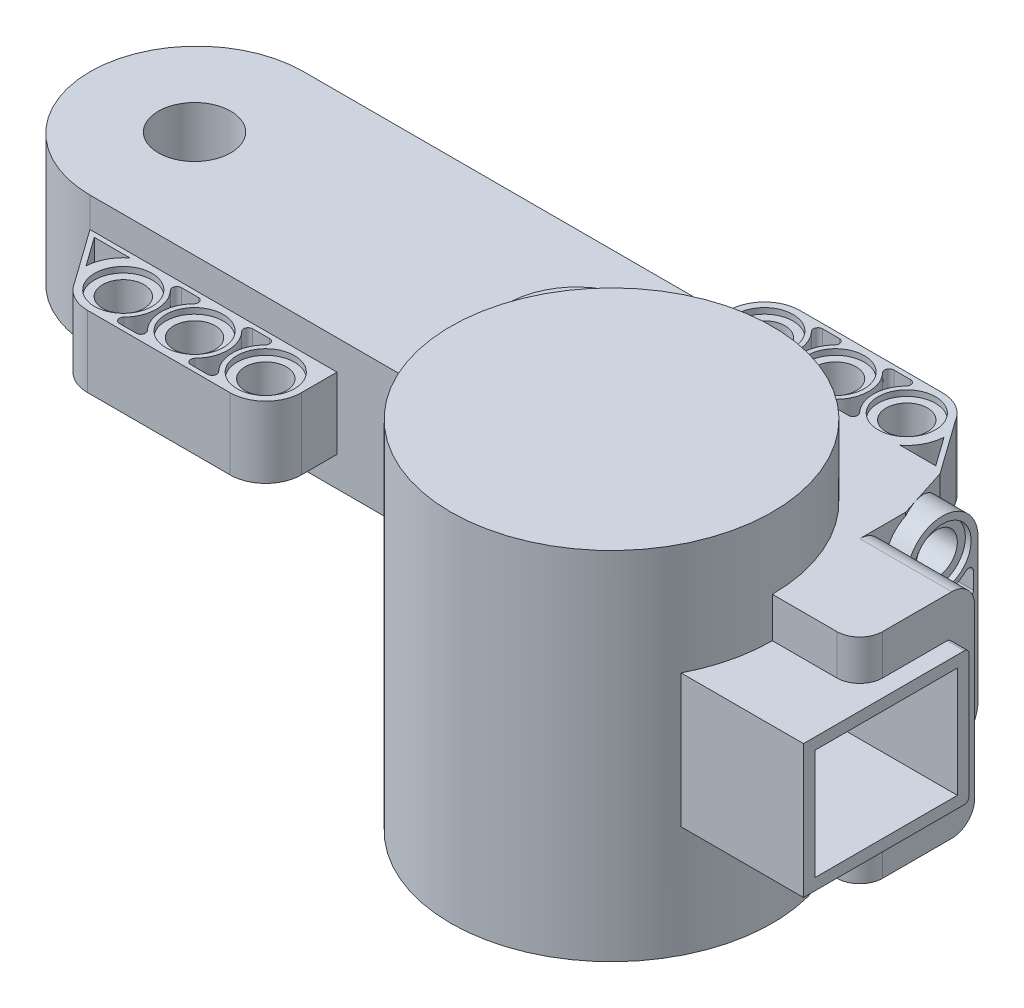
from build123d import *
from OCP.BRepAlgoAPI import BRepAlgoAPI_Cut
from OCP.TopTools import TopTools_ListOfShape

# Parameters (mm, degrees)
EXTRUDE1_DEPTH          = 3.937
SKETCH2_R               = 3.175
CUT_EXTRUDE1_DEPTH      = 0.635
SKETCH3_R               = 2.286
CUT_EXTRUDE2_DEPTH      = 21.34459137
LPATTERN12_COUNT        = 3
LPATTERN12_PITCH        = 7.874
CUT_EXTRUDE4_DEPTH      = 3.175
LPATTERN13_COUNT        = 2
LPATTERN13_PITCH        = 7.874
EXTRUDE2_START          = -7.874
EXTRUDE2_DEPTH          = 7.874
EXTRUDE3_DEPTH          = 7.874
EXTRUDE4_DEPTH          = 7.874
SKETCH9_R               = 17.78
EXTRUDE5_DEPTH          = 9.525
FILLET1_R               = 2.54
SKETCH10_W              = 18.288
SKETCH10_H              = 3.429
CUT_EXTRUDE5_DEPTH      = 12.065
FILLET2_R               = 0.508
CUT_EXTRUDE6_DEPTH      = 31.75
BODY_MOVE_COPY8_ANGLE   = 90
EXTRUDE6_DEPTH          = 3.937
EXTRUDE6_DEPTH_BACK     = 3.81
SKETCH13_R              = 4.0005
CUT_EXTRUDE7_DEPTH      = 95.795270547
EXTRUDE7_DEPTH          = 3.937
EXTRUDE12_DEPTH         = 0.508
BODY_MOVE_COPY2_ANGLE   = 180
SKETCH16_W              = 15.748
SKETCH16_H              = 12.192
EXTRUDE8_DEPTH          = 13.97
EXTRUDE13_START         = -1.651
EXTRUDE13_OUTLINE_R     = 17.78
EXTRUDE13_DEPTH         = 1.651
SKETCH24_R              = 17.78
EXTRUDE14_DEPTH         = 1.651
BOSS_EXTRUDE1_DEPTH     = 26.27892146
SKETCH31_W              = 1.651
SKETCH31_H              = 7.874
BOSS_EXTRUDE2_DEPTH     = 23.622
CUT_EXTRUDE8_DEPTH      = 0.762
CUT_EXTRUDE8_DEPTH_BACK = 0.254


with BuildPart() as part:
    # Sketch1 → Extrude1 (new body)
    with BuildSketch(Plane(origin=(0, 0, 0), x_dir=(1, 0, 0), z_dir=(0, 1, 0))):
        with BuildLine():
            Line((-15.748, -3.937), (0, -3.937))
            ThreePointArc((0, -3.937), (3.937, 0), (0, 3.937))
            Line((0, 3.937), (-15.748, 3.937))
            ThreePointArc((-15.748, 3.937), (-19.685, 0), (-15.748, -3.937))
        make_face()
    extrude(amount=EXTRUDE1_DEPTH)

    # Sketch2 → Cut-Extrude1 (cut)
    with BuildSketch(Plane.XZ):
        with Locations(Location((0, 0, 0), (0, 0, 270))):
            Circle(SKETCH2_R)
    cut_extrude1 = extrude(amount=-CUT_EXTRUDE1_DEPTH, mode=Mode.SUBTRACT)

    # Sketch3 → Cut-Extrude2 (cut, through all)
    with BuildSketch(Plane.XZ.offset(-0.635)):
        with Locations(Location((0, 0, 0), (0, 0, 270))):
            Circle(SKETCH3_R)
    cut_extrude2 = extrude(amount=-CUT_EXTRUDE2_DEPTH, mode=Mode.SUBTRACT)

    # LPattern12: Cut-Extrude1, Cut-Extrude2 ×3
    with Locations(*[(-i * LPATTERN12_PITCH, 0, 0) for i in range(1, LPATTERN12_COUNT)]):
        add(cut_extrude1, mode=Mode.SUBTRACT)
        add(cut_extrude2, mode=Mode.SUBTRACT)

    # Sketch5 → Cut-Extrude4 (cut)
    with BuildSketch(Plane.XZ):
        with BuildLine():
            Line((-4.86863147, 3.429), (-3.00536853, 3.429))
            ThreePointArc((-3.00536853, 3.429), (-2.537433284, 3.118738732), (-2.641081435, 2.566939394))
            ThreePointArc((-2.641081435, 2.566939394), (-3.683, 0), (-2.641081435, -2.566939394))
            ThreePointArc((-2.641081435, -2.566939394), (-2.537433284, -3.118738732), (-3.00536853, -3.429))
            Line((-3.00536853, -3.429), (-4.86863147, -3.429))
            ThreePointArc((-4.86863147, -3.429), (-5.336566716, -3.118738732), (-5.232918565, -2.566939394))
            ThreePointArc((-5.232918565, -2.566939394), (-4.191, 0), (-5.232918565, 2.566939394))
            ThreePointArc((-5.232918565, 2.566939394), (-5.336566716, 3.118738732), (-4.86863147, 3.429))
        make_face()
    cut_extrude4 = extrude(amount=-CUT_EXTRUDE4_DEPTH, mode=Mode.SUBTRACT)

    # LPattern13: Cut-Extrude4 ×2
    with Locations(*[(-i * LPATTERN13_PITCH, 0, 0) for i in range(1, LPATTERN13_COUNT)]):
        add(cut_extrude4, mode=Mode.SUBTRACT)

    # Mirror1: part across plane


with BuildPart() as part_1:
    add(part.part)
    add(part.part.mirror(Plane(origin=(-15.748, 3.937, 0), x_dir=(0, 0, 1), z_dir=(0, 1, 0))))


with BuildPart() as body_2:
    # Body-Move/Copy7: copy of part
    add(part_1.part.moved(Location((-50.8, 0, 0))))


with BuildPart() as part_2:
    add(part_1.part)

    # Sketch6 → Extrude2 (add)
    with BuildSketch(Plane(origin=(0, 7.874, 0), x_dir=(1, 0, 0), z_dir=(0, 1, 0)).offset(EXTRUDE2_START)):
        with BuildLine():
            Line((0, -3.937), (7.62, -3.937))
            Line((7.62, -3.937), (3.427025907, 1.937901554))
            ThreePointArc((3.427025907, 1.937901554), (3.400697533, -1.983740227), (0, -3.937))
        make_face()
        with BuildLine():
            Line((2.688083332, -3.429), (6.633322491, -3.429))
            Line((6.633322491, -3.429), (4.350913644, -0.231048621))
            ThreePointArc((4.350913644, -0.231048621), (3.865694357, -2.01003486), (2.688083332, -3.429))
        make_face(mode=Mode.SUBTRACT)
    extrude(amount=EXTRUDE2_DEPTH)

    # Sketch7 → Extrude3 (add)
    with BuildSketch(Plane.XZ):
        with BuildLine():
            Line((-19.685, 0), (-19.685, 3.937))
            Line((-19.685, 3.937), (-15.748, 3.937))
            ThreePointArc((-15.748, 3.937), (-18.531879398, 2.783879398), (-19.685, 0))
        make_face()
    extrude(amount=-EXTRUDE3_DEPTH)


with BuildPart() as body_3:
    # Body-Move/Copy1: copy of part
    add(part_2.part.moved(Location((50.8, 0, 0))))


with BuildPart() as body_4:
    # Sketch8 → Extrude4 (new body)
    with BuildSketch(Plane(origin=(0, 7.874, 0), x_dir=(1, 0, 0), z_dir=(0, 1, 0))):
        with BuildLine():
            Line((-24.088558034, -32.059964549), (-31.906305796, -14.683413378))
            ThreePointArc((-31.906305796, -14.683413378), (-31.355946478, -7.419299548), (-24.957209496, -3.937))
            Line((-24.957209496, -3.937), (-19.685, -3.937))
            Line((-19.685, -3.937), (7.62, -3.937))
            Line((7.62, -3.937), (9.40807854, -9.525))
            Line((9.40807854, -9.525), (9.40807854, -12.065))
            Line((9.40807854, -12.065), (19.56807854, -12.065))
            Line((19.56807854, -12.065), (19.56807854, -24.765))
            Line((19.56807854, -24.765), (9.906, -24.765))
            ThreePointArc((9.906, -24.765), (-4.143480052, -42.149234838), (-24.088558034, -32.059964549))
        make_face()
    extrude(amount=-EXTRUDE4_DEPTH)

    # Combine3: union part
    add(part_2.part)

    # Sketch9 → Extrude5 (add)
    with BuildSketch(Plane(origin=(0, 7.874, 0), x_dir=(1, 0, 0), z_dir=(0, 1, 0))):
        with Locations(Location((-7.874, -24.765, 0), (0, 0, 270))):
            Circle(SKETCH9_R)
    extrude(amount=EXTRUDE5_DEPTH)

    # Fillet1
    fillet1_edges = [body_4.edges().sort_by_distance(p)[0] for p in [
        (14.48807854, 7.874, 12.065),
        (19.56807854, 3.937, 24.765),
    ]]
    fillet(fillet1_edges, radius=FILLET1_R)

    # Sketch10 → Cut-Extrude5 (cut)
    with BuildSketch(Plane(origin=(19.56807854, 0, 0), x_dir=(0, 0, -1), z_dir=(1, 0, 0))):
        with Locations((-23.749, 1.7145)):
            Rectangle(SKETCH10_W, SKETCH10_H)
    extrude(amount=-CUT_EXTRUDE5_DEPTH, mode=Mode.SUBTRACT)

    # Fillet2
    fillet2_edges = [body_4.edges().sort_by_distance(p)[0] for p in [
        (13.53557854, 3.429, 14.605),
    ]]
    fillet(fillet2_edges, radius=FILLET2_R)

    # Sketch11 → Cut-Extrude6 (cut)
    with BuildSketch(Plane(origin=(9.40807854, 0, 0), x_dir=(0, 0, -1), z_dir=(1, 0, 0))):
        with BuildLine():
            Line((-5.588, 3.937), (-5.588, -30.276715145))
            Line((-5.588, -30.276715145), (-10.16, -30.276715145))
            Line((-10.16, -30.276715145), (-10.16, 3.937))
            ThreePointArc((-10.16, 3.937), (-7.874, 6.223), (-5.588, 3.937))
        make_face()
    extrude(amount=-CUT_EXTRUDE6_DEPTH, mode=Mode.SUBTRACT)


with BuildPart() as body_2_1:
    # Body-Move/Copy8: read off the stored shape, not the designer's step
    # Body-Move/Copy8: moved
    add(body_2.part.moved(Location((54.737, -11.811, 7.874))).rotate(Axis((0, 0, 0), (0, 0, 1)), BODY_MOVE_COPY8_ANGLE))

    # Combine5: union body 4
    add(body_4.part)

    # Sketch12 → Extrude6 (add, two sides: drawn at the far end of the back side and taken through both)
    with BuildSketch(Plane.XZ.offset(-EXTRUDE6_DEPTH_BACK)):
        with BuildLine():
            Line((-27.559, -3.937), (-70.612, -3.937))
            ThreePointArc((-70.612, -3.937), (-82.423, 7.874), (-70.612, 19.685))
            Line((-70.612, 19.685), (-29.656081213, 19.685))
            Line((-29.656081213, 19.685), (-19.685, 10.275115534))
            Line((-19.685, 10.275115534), (-19.685, 3.937))
            Line((-19.685, 3.937), (-27.559, -3.937))
        make_face()
    extrude(amount=EXTRUDE6_DEPTH + EXTRUDE6_DEPTH_BACK)

    # Sketch13 → Cut-Extrude7 (cut, through all)
    with BuildSketch(Plane(origin=(0, 3.81, 0), x_dir=(1, 0, 0), z_dir=(0, 1, 0))):
        with Locations(Location((-70.866, -7.874, 0), (0, 0, 270))):
            Circle(SKETCH13_R)
    extrude(amount=-CUT_EXTRUDE7_DEPTH, mode=Mode.SUBTRACT)

    # Sketch15 → Extrude7 (add)
    with BuildSketch(Plane.XZ):
        with BuildLine():
            Line((-24.088558034, 32.059964549), (-29.656081213, 19.685))
            Line((-29.656081213, 19.685), (-19.685, 10.275115534))
            Line((-19.685, 10.275115534), (-19.685, 10.16))
            Line((-19.685, 10.16), (7.112, 10.16))
            Line((7.112, 10.16), (7.112, 11.303))
            Line((7.112, 11.303), (3.937, 11.303))
            Line((3.937, 11.303), (3.937, 11.811))
            Line((3.937, 11.811), (9.40807854, 11.811))
            Line((9.40807854, 11.811), (9.40807854, 12.065))
            Line((9.40807854, 12.065), (19.56807854, 12.065))
            Line((19.56807854, 12.065), (19.56807854, 14.605))
            Line((19.56807854, 14.605), (7.50307854, 14.605))
            Line((7.50307854, 14.605), (7.50307854, 32.893))
            Line((7.50307854, 32.893), (7.939412535, 32.893))
            ThreePointArc((7.939412535, 32.893), (-8.336294758, 42.53898896), (-24.088558034, 32.059964549))
        make_face()
    extrude(amount=EXTRUDE7_DEPTH)

    # Sketch25 → Extrude12 (cut)
    with BuildSketch(Plane(origin=(0, 3.81, 0), x_dir=(1, 0, 0), z_dir=(0, 1, 0))):
        with BuildLine():
            Line((-29.656081213, -19.685), (-31.906305796, -14.683413378))
            ThreePointArc((-31.906305796, -14.683413378), (-31.355946478, -7.419299548), (-24.957209496, -3.937))
            Line((-24.957209496, -3.937), (-19.685, -3.937))
            Line((-19.685, -3.937), (-27.559, 3.937))
            Line((-27.559, 3.937), (-70.612, 3.937))
            ThreePointArc((-70.612, 3.937), (-82.423, -7.874), (-70.612, -19.685))
            Line((-70.612, -19.685), (-29.656081213, -19.685))
        make_face()
    extrude(amount=-EXTRUDE12_DEPTH, mode=Mode.SUBTRACT)


with BuildPart() as body_3_2:
    # Mirror2: read off the stored shape, not the designer's step
    # Mirror2: mirrored copy
    add(body_2_1.part.mirror(Plane(origin=(0, -3.937, 0), x_dir=(1, 0, 0), z_dir=(0, 1, 0))))


with BuildPart() as body_2_2:
    add(body_2_1.part)

    # Combine1: union body 3 2
    add(body_3_2.part)

    # Sketch16 → Extrude8 (add)
    with BuildSketch(Plane(origin=(7.50307854, 0, 0), x_dir=(0, 0, -1), z_dir=(1, 0, 0))):
        with BuildLine():
            Line((-32.893, -11.303), (-15.113, -11.303))
            ThreePointArc((-15.113, -11.303), (-14.753789755, -11.154210245), (-14.605, -10.795))
            Line((-14.605, -10.795), (-14.605, 2.921))
            ThreePointArc((-14.605, 2.921), (-14.753789755, 3.280210245), (-15.113, 3.429))
            Line((-15.113, 3.429), (-32.893, 3.429))
            Line((-32.893, 3.429), (-32.893, -11.303))
        make_face()
        with Locations((-23.749, -3.937)):
            Rectangle(SKETCH16_W, SKETCH16_H, mode=Mode.SUBTRACT)
    extrude(amount=EXTRUDE8_DEPTH)


with BuildPart() as body_3_1:
    # Body-Move/Copy2: read off the stored shape, not the designer's step
    # Body-Move/Copy2: moved
    add(body_3.part.moved(Location((12.192, -7.874, -23.622))).rotate(Axis((0, 0, 0), (0, 1, 0)), BODY_MOVE_COPY2_ANGLE))


with BuildPart() as extrude13_tool:
    # Extrude13: read off the stored shape, not the designer's step
    # Extrude13 outline → Extrude13 (new body)
    with BuildSketch(Plane.XZ.offset(25.273).offset(EXTRUDE13_START)):
        with Locations((-7.874, 24.765)):
            Circle(EXTRUDE13_OUTLINE_R)
    extrude(amount=EXTRUDE13_DEPTH)


with BuildPart() as body_2_3:
    add(body_2_2.part)

    # Extrude13: cut by extrude13_tool, with a tolerance
    extrude13_stock = TopTools_ListOfShape()
    extrude13_stock.Append(body_2_3.part.wrapped)
    extrude13_tools = TopTools_ListOfShape()
    extrude13_tools.Append(extrude13_tool.part.wrapped)
    extrude13_cut = BRepAlgoAPI_Cut()
    extrude13_cut.SetArguments(extrude13_stock)
    extrude13_cut.SetTools(extrude13_tools)
    extrude13_cut.SetFuzzyValue(0.00001)
    extrude13_cut.Build()
    add(Compound.cast(extrude13_cut.Shape()).solids(), mode=Mode.REPLACE)

    # Sketch24 → Extrude14 (cut)
    with BuildSketch(Plane(origin=(0, 17.399, 0), x_dir=(1, 0, 0), z_dir=(0, 1, 0))):
        with Locations(Location((-7.874, -24.765, 0), (0, 0, 270))):
            Circle(SKETCH24_R)
    extrude(amount=-EXTRUDE14_DEPTH, mode=Mode.SUBTRACT)

    # Sketch30 → Boss-Extrude1 (add)
    with BuildSketch(Plane(origin=(-22.34192146, 0, 0), x_dir=(0, 0, -1), z_dir=(1, 0, 0))):
        with BuildLine():
            Line((-10.16, 3.937), (-10.16, -11.811))
            ThreePointArc((-10.16, -11.811), (-7.8105, -14.0335), (-5.588, -11.684))
            Line((-5.588, -11.684), (-5.588, -7.874))
            Line((-5.588, -7.874), (-5.588, 3.81))
            Line((-5.588, 3.81), (-5.588, 3.937))
            ThreePointArc((-5.588, 3.937), (-7.874, 6.223), (-10.16, 3.937))
        make_face()
    extrude(amount=BOSS_EXTRUDE1_DEPTH)

    # Sketch31 → Boss-Extrude2 (add)
    with BuildSketch(Plane(origin=(-19.685, 0, 0), x_dir=(0, 0, -1), z_dir=(1, 0, 0))):
        with Locations((-4.7625, -3.937)):
            Rectangle(SKETCH31_W, SKETCH31_H)
    extrude(amount=BOSS_EXTRUDE2_DEPTH)

    # Sketch32 → Cut-Extrude8 (cut, two sides: drawn at the far end of the back side and taken through both)
    with BuildSketch(Plane(origin=(3.937, 0, 0), x_dir=(0, 0, -1), z_dir=(1, 0, 0)).offset(-CUT_EXTRUDE8_DEPTH_BACK)):
        with BuildLine():
            Line((-10.414, -11.811), (-10.414, 3.937))
            ThreePointArc((-10.414, 3.937), (-7.874, 6.477), (-5.334, 3.937))
            Line((-5.334, 3.937), (-5.334, -11.811))
            ThreePointArc((-5.334, -11.811), (-7.874, -14.351), (-10.414, -11.811))
        make_face()
    extrude(amount=CUT_EXTRUDE8_DEPTH + CUT_EXTRUDE8_DEPTH_BACK, mode=Mode.SUBTRACT)


solid = Compound([body_3_1.part, body_2_3.part])
